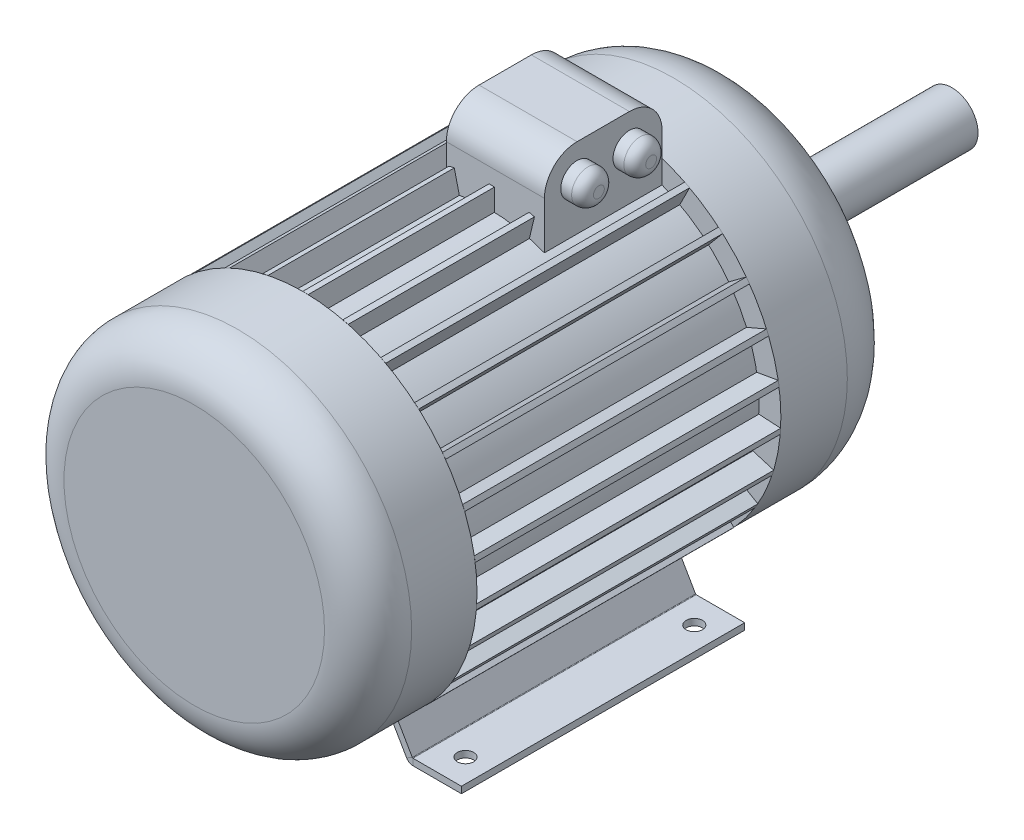
from build123d import *

# Parameters (mm, degrees)
SKETCH1_R           = 139.5
BOSS_EXTRUDE1_DEPTH = 279
SKETCH2_R           = 159.579550472
BOSS_EXTRUDE2_DEPTH = 100
FILLET1_R           = 40
BOSS_EXTRUDE5_DEPTH = 279
CIRPATTERN2_DEPTH   = 279
SKETCH4_R           = 24
BOSS_EXTRUDE6_DEPTH = 316.48
SKETCH6_R           = 159.5
BOSS_EXTRUDE7_DEPTH = 121
FILLET2_R           = 60
BASE_FLANGE1_DEPTH  = 260
BOSS_EXTRUDE8_DEPTH = 108
FILLET3_R           = 30
SKETCH13_R          = 15
BOSS_EXTRUDE9_DEPTH = 20
FILLET4_R           = 10
SKETCH16_R          = 7.5
CUT_EXTRUDE2_DEPTH  = 6


# Read off the part's stored shape, not the designer's step: CirPattern2
# Sheet-metal steps are written as plain solids
with BuildPart() as part:
    # Sketch1 → Boss-Extrude1 (new body)
    with BuildSketch(Plane.XY):
        Circle(SKETCH1_R)
    extrude(amount=BOSS_EXTRUDE1_DEPTH)

    # Sketch2 → Boss-Extrude2 (add)
    with BuildSketch(Plane.XY.offset(279)):
        Circle(SKETCH2_R)
    extrude(amount=BOSS_EXTRUDE2_DEPTH)

    # Fillet1
    fillet1_edges = [part.edges().sort_by_distance(p)[0] for p in [
        (-159.579550472, 0, 379),
    ]]
    fillet(fillet1_edges, radius=FILLET1_R)

    # Sketch4 → Boss-Extrude6 (add)
    with BuildSketch(Plane(origin=(0, 0, 0), x_dir=(-1, 0, 0), z_dir=(0, 0, -1))):
        Circle(SKETCH4_R)
    extrude(amount=BOSS_EXTRUDE6_DEPTH)



with BuildPart() as body_2:
    # Sketch3 → Boss-Extrude5 (new body)
    with BuildSketch(Plane(origin=(0, 0, 0), x_dir=(-1, 0, 0), z_dir=(0, 0, -1))):
        with BuildLine():
            Line((0.383374096, 139.499473204), (0.383374096, 159.579089962))
            ThreePointArc((0.383374096, 159.579089962), (-2.116665738, 159.56551211), (-4.61618605, 159.512769881))
            Line((-4.61618605, 159.512769881), (-4.61618605, 139.423602114))
            ThreePointArc((-4.61618605, 139.423602114), (-2.116745938, 139.483939529), (0.383374096, 139.499473204))
        make_face()
    extrude(amount=-BOSS_EXTRUDE5_DEPTH)


with BuildPart() as body_3:
    # CirPattern2 outline → CirPattern2 (new body)
    with BuildSketch(Plane.XY):
        with BuildLine():
            ThreePointArc((41.277932478, 154.14851676), (38.857950255, 154.776266368), (36.428430587, 155.36602709))
            Line((36.428430587, 155.36602709), (31.797752284, 135.827659001))
            ThreePointArc((31.797752284, 135.827659001), (34.226898946, 135.23597668), (36.645051561, 134.600855109))
            Line((36.645051561, 134.600855109), (41.277932478, 154.14851676))
        make_face()
        with BuildLine():
            ThreePointArc((75.714374882, 140.4740772), (73.504392616, 141.642992043), (71.276369147, 142.777141483))
            Line((71.276369147, 142.777141483), (62.264653607, 124.833340543))
            ThreePointArc((62.264653607, 124.833340543), (64.491870973, 123.697407323), (66.698372857, 122.521741165))
            Line((66.698372857, 122.521741165), (75.714374882, 140.4740772))
        make_face()
        with BuildLine():
            ThreePointArc((106.069035738, 119.226643777), (104.188194144, 120.873707355), (102.281780197, 122.491103222))
            Line((102.281780197, 122.491103222), (89.374851338, 107.109224385))
            ThreePointArc((89.374851338, 107.109224385), (91.280069543, 105.490278719), (93.155967608, 103.837448442))
            Line((93.155967608, 103.837448442), (106.069035738, 119.226643777))
        make_face()
        with BuildLine():
            ThreePointArc((130.705487423, 91.551671128), (129.255183159, 93.588089816), (127.773154002, 95.601537881))
            Line((127.773154002, 95.601537881), (111.666827699, 83.610822216))
            ThreePointArc((111.666827699, 83.610822216), (113.147335937, 81.596141885), (114.591500033, 79.555251996))
            Line((114.591500033, 79.555251996), (130.705487423, 91.551671128))
        make_face()
        with BuildLine():
            ThreePointArc((148.295572449, 58.941124192), (147.353991793, 61.257114131), (146.376244002, 63.558068887))
            Line((146.376244002, 63.558068887), (127.938816475, 55.604938979))
            ThreePointArc((127.938816475, 55.604938979), (128.914800163, 53.303135921), (129.849375031, 50.984211322))
            Line((129.849375031, 50.984211322), (148.295572449, 58.941124192))
        make_face()
        with BuildLine():
            ThreePointArc((157.891004779, 23.153045993), (157.508908588, 25.623751566), (157.0881528, 28.088167947))
            Line((157.0881528, 28.088167947), (137.31359054, 24.601379089))
            ThreePointArc((137.31359054, 24.601379089), (137.732434144, 22.136544102), (138.10703661, 19.66459862))
            Line((138.10703661, 19.66459862), (157.891004779, 23.153045993))
        make_face()
        with BuildLine():
            ThreePointArc((158.974492173, -13.883218907), (159.172479351, -11.390994076), (159.33139862, -8.895973396))
            Line((159.33139862, -8.895973396), (139.285753396, -7.728447515))
            ThreePointArc((139.285753396, -7.728447515), (139.12487695, -10.223434538), (138.919312098, -12.715137684))
            Line((138.919312098, -12.715137684), (158.974492173, -13.883218907))
        make_face()
        with BuildLine():
            ThreePointArc((151.487623545, -50.171035883), (152.255020552, -47.79164828), (152.985047499, -45.400530511))
            Line((152.985047499, -45.400530511), (133.748985233, -39.641631514))
            ThreePointArc((133.748985233, -39.641631514), (133.017061628, -42.032265177), (132.242411512, -44.409397625))
            Line((132.242411512, -44.409397625), (151.487623545, -50.171035883))
        make_face()
        with BuildLine():
            ThreePointArc((135.83401792, -83.754119328), (137.129454186, -81.615842356), (138.391232868, -79.457533275))
            Line((138.391232868, -79.457533275), (121.001774657, -69.417724896))
            ThreePointArc((121.001774657, -69.417724896), (119.738262083, -71.57512552), (118.436288293, -73.709535444))
            Line((118.436288293, -73.709535444), (135.83401792, -83.754119328))
        make_face()
        with BuildLine():
            ThreePointArc((112.85756523, -112.821996521), (114.61120345, -111.040105244), (116.336711052, -109.230959853))
            Line((116.336711052, -109.230959853), (101.73132709, -95.451490762))
            ThreePointArc((101.73132709, -95.451490762), (100.004341837, -97.25935232), (98.245234115, -99.035973129))
            Line((98.245234115, -99.035973129), (112.85756523, -112.821996521))
        make_face()
        with BuildLine():
            ThreePointArc((83.796931987, -135.807610679), (85.91423307, -134.478167317), (88.010447031, -133.115717112))
            Line((88.010447031, -133.115717112), (76.976517346, -116.339442053))
            ThreePointArc((76.976517346, -116.339442053), (74.879161637, -117.700302262), (72.757753937, -119.023355868))
            Line((72.757753937, -119.023355868), (83.796931987, -135.807610679))
        make_face()
        with BuildLine():
            ThreePointArc((-91.510466346, -130.734339322), (-89.45112992, -132.151913663), (-87.369838262, -133.537052127))
            Line((-87.369838262, -133.537052127), (-76.335908578, -116.760777068))
            ThreePointArc((-76.335908578, -116.760777068), (-78.416192499, -115.373960468), (-80.471288296, -113.950084511))
            Line((-80.471288296, -113.950084511), (-91.510466346, -130.734339322))
        make_face()
        with BuildLine():
            ThreePointArc((-119.193203381, -106.106612407), (-117.516291776, -107.960891512), (-115.810536517, -109.788672277))
            Line((-115.810536517, -109.788672277), (-101.205152555, -96.009203186))
            ThreePointArc((-101.205152555, -96.009203186), (-102.909540236, -94.180021918), (-104.580872266, -92.320589015))
            Line((-104.580872266, -92.320589015), (-119.193203381, -106.106612407))
        make_face()
        with BuildLine():
            ThreePointArc((-140.45020397, -75.758650553), (-139.246119924, -77.949669754), (-138.007858772, -80.121556687))
            Line((-138.007858772, -80.121556687), (-120.618400562, -70.081748308))
            ThreePointArc((-120.618400562, -70.081748308), (-121.855008021, -67.908814009), (-123.052474342, -65.714066669))
            Line((-123.052474342, -65.714066669), (-140.45020397, -75.758650553))
        make_face()
        with BuildLine():
            ThreePointArc((-154.135497708, -41.326520238), (-153.469153705, -43.736161124), (-152.765141639, -46.135067237))
            Line((-152.765141639, -46.135067237), (-133.529079373, -40.376168239))
            ThreePointArc((-133.529079373, -40.376168239), (-134.231240783, -37.976624359), (-134.890285676, -35.56488198))
            Line((-134.890285676, -35.56488198), (-154.135497708, -41.326520238))
        make_face()
        with BuildLine():
            ThreePointArc((-159.511306869, -4.66646652), (-159.418625686, -7.164824727), (-159.286816177, -9.661424371))
            Line((-159.286816177, -9.661424371), (-139.241170953, -8.49389849))
            ThreePointArc((-139.241170953, -8.49389849), (-139.37103261, -5.997105061), (-139.456126794, -3.498385297))
            Line((-139.456126794, -3.498385297), (-159.511306869, -4.66646652))
        make_face()
        with BuildLine():
            ThreePointArc((-156.287820188, 32.245157616), (-156.773798291, 29.792769226), (-157.221297226, 27.333068384))
            Line((-157.221297226, 27.333068384), (-137.446734966, 23.846279526))
            ThreePointArc((-137.446734966, 23.846279526), (-136.997295995, 26.305719724), (-136.503852019, 28.756710242))
            Line((-136.503852019, 28.756710242), (-156.287820188, 32.245157616))
        make_face()
        with BuildLine():
            ThreePointArc((-144.638816667, 67.418436958), (-145.677254852, 65.144227278), (-146.679937447, 62.854028347))
            Line((-146.679937447, 62.854028347), (-128.24250992, 54.90089844))
            ThreePointArc((-128.24250992, 54.90089844), (-127.237999691, 57.190396349), (-126.192619249, 59.461524089))
            Line((-126.192619249, 59.461524089), (-144.638816667, 67.418436958))
        make_face()
        with BuildLine():
            ThreePointArc((-125.192297102, 98.957170913), (-126.727212896, 96.983743176), (-128.231024272, 94.986511373))
            Line((-128.231024272, 94.986511373), (-112.124697969, 82.995795708))
            ThreePointArc((-112.124697969, 82.995795708), (-110.61926989, 84.991923904), (-109.078309712, 86.960751781))
            Line((-109.078309712, 86.960751781), (-125.192297102, 98.957170913))
        make_face()
        with BuildLine():
            ThreePointArc((-98.996628395, 125.161098171), (-100.945274091, 123.594840376), (-102.869143388, 121.998246985))
            Line((-102.869143388, 121.998246985), (-89.962214529, 106.616368148))
            ThreePointArc((-89.962214529, 106.616368148), (-88.037026616, 108.211514843), (-86.083560265, 109.771902836))
            Line((-86.083560265, 109.771902836), (-98.996628395, 125.161098171))
        make_face()
        with BuildLine():
            ThreePointArc((-67.464025826, 144.617558229), (-69.721349431, 143.54290774), (-71.961560357, 142.433025523))
            Line((-71.961560357, 142.433025523), (-62.949844818, 124.489224584))
            ThreePointArc((-62.949844818, 124.489224584), (-60.708684451, 125.597395006), (-58.448023801, 126.665222195))
            Line((-58.448023801, 126.665222195), (-67.464025826, 144.617558229))
        make_face()
        with BuildLine():
            ThreePointArc((-32.294420163, 156.27764829), (-34.738728776, 155.752539793), (-37.174510981, 155.189202789))
            Line((-37.174510981, 155.189202789), (-32.543832678, 135.650834699))
            ThreePointArc((-32.543832678, 135.650834699), (-30.107521392, 136.212287095), (-27.661539246, 136.72998664))
            Line((-27.661539246, 136.72998664), (-32.294420163, 156.27764829))
        make_face()
    extrude(amount=CIRPATTERN2_DEPTH)


with BuildPart() as body_4:
    # Sketch6 → Boss-Extrude7 (new body)
    with BuildSketch(Plane(origin=(0, 0, 0), x_dir=(-1, 0, 0), z_dir=(0, 0, -1))):
        Circle(SKETCH6_R)
    extrude(amount=BOSS_EXTRUDE7_DEPTH)

    # Fillet2
    fillet2_edges = [body_4.edges().sort_by_distance(p)[0] for p in [
        (159.5, 0, -121),
    ]]
    fillet(fillet2_edges, radius=FILLET2_R)


with BuildPart() as body_5:
    # Sketch7 → Base-Flange1 (new body)
    with BuildSketch(Plane(origin=(0, 0, 0), x_dir=(-1, 0, 0), z_dir=(0, 0, -1))):
        with BuildLine():
            Line((-126.277303496, -180), (-81.791725394, -180))
            ThreePointArc((-81.791725394, -180), (-81.423425394, -179.901314312), (-81.153811082, -179.6317))
            Line((-81.153811082, -179.6317), (-59.928452195, -142.8683))
            ThreePointArc((-59.928452195, -142.8683), (-57.46268546, -140.402533265), (-54.09438546, -139.5))
            Line((-54.09438546, -139.5), (54.09438546, -139.5))
            ThreePointArc((54.09438546, -139.5), (57.46268546, -140.402533265), (59.928452195, -142.8683))
            Line((59.928452195, -142.8683), (81.153811082, -179.6317))
            ThreePointArc((81.153811082, -179.6317), (81.423425394, -179.901314312), (81.791725394, -180))
            Line((81.791725394, -180), (126.277303496, -180))
            Line((126.277303496, -180), (126.277303496, -186))
            Line((126.277303496, -186), (81.791725394, -186))
            ThreePointArc((81.791725394, -186), (78.423425394, -185.097466735), (75.957658659, -182.6317))
            Line((75.957658659, -182.6317), (54.732299773, -145.8683))
            ThreePointArc((54.732299773, -145.8683), (54.46268546, -145.598685688), (54.09438546, -145.5))
            Line((54.09438546, -145.5), (-54.09438546, -145.5))
            ThreePointArc((-54.09438546, -145.5), (-54.46268546, -145.598685688), (-54.732299773, -145.8683))
            Line((-54.732299773, -145.8683), (-75.957658659, -182.6317))
            ThreePointArc((-75.957658659, -182.6317), (-78.423425394, -185.097466735), (-81.791725394, -186))
            Line((-81.791725394, -186), (-126.277303496, -186))
            Line((-126.277303496, -186), (-126.277303496, -180))
        make_face()
    extrude(amount=-BASE_FLANGE1_DEPTH)

    # Sketch16 → Cut-Extrude2 (cut)
    with BuildSketch(Plane.XZ.offset(186)):
        with Locations(Location((105, 235, 0), (0, 0, 270))):
            Circle(SKETCH16_R)
        with Locations(Location((105, 25, 0), (0, 0, 90))):
            Circle(SKETCH16_R)
        with Locations(Location((-105, 235, 0), (0, 0, 180))):
            Circle(SKETCH16_R)
        with Locations(Location((-105, 25, 0), (0, 0, 270))):
            Circle(SKETCH16_R)
    extrude(amount=-CUT_EXTRUDE2_DEPTH, mode=Mode.SUBTRACT)


with BuildPart() as body_6:
    # Sketch12 → Boss-Extrude8 (new body)
    with BuildSketch(Plane(origin=(0, 0, 0), x_dir=(-1, 0, 0), z_dir=(0, 0, -1))):
        with BuildLine():
            Line((-50.416267855, 130.070941934), (-50.416267855, 203.462363467))
            Line((-50.416267855, 203.462363467), (39.583732145, 203.462363467))
            Line((39.583732145, 203.462363467), (39.583732145, 133.766132296))
            ThreePointArc((39.583732145, 133.766132296), (-5.722723602, 139.382568618), (-50.416267855, 130.070941934))
        make_face()
    extrude(amount=-BOSS_EXTRUDE8_DEPTH)

    # Fillet3
    fillet3_edges = [body_6.edges().sort_by_distance(p)[0] for p in [
        (5.416267855, 203.462363467, 108),
        (5.416267855, 203.462363467, 0),
    ]]
    fillet(fillet3_edges, radius=FILLET3_R)


with BuildPart() as part_1:
    add(part.part)

    add(body_6.part)  # Boss-Extrude9 merges body 6
    # Sketch13 → Boss-Extrude9 (add)
    with BuildSketch(Plane(origin=(50.416267855, 0, 0), x_dir=(0, 0, -1), z_dir=(1, 0, 0))):
        with Locations((-78, 173.462363467)):
            Circle(SKETCH13_R)
        with Locations((-30, 173.462363467)):
            Circle(SKETCH13_R)
    extrude(amount=BOSS_EXTRUDE9_DEPTH)

    # Fillet4
    fillet4_edges = [part_1.edges().sort_by_distance(p)[0] for p in [
        (70.416267855, 173.462363467, 93),
        (70.416267855, 173.462363467, 45),
    ]]
    fillet(fillet4_edges, radius=FILLET4_R)


solid = Compound([body_2.part, body_3.part, body_4.part, body_5.part, part_1.part])
